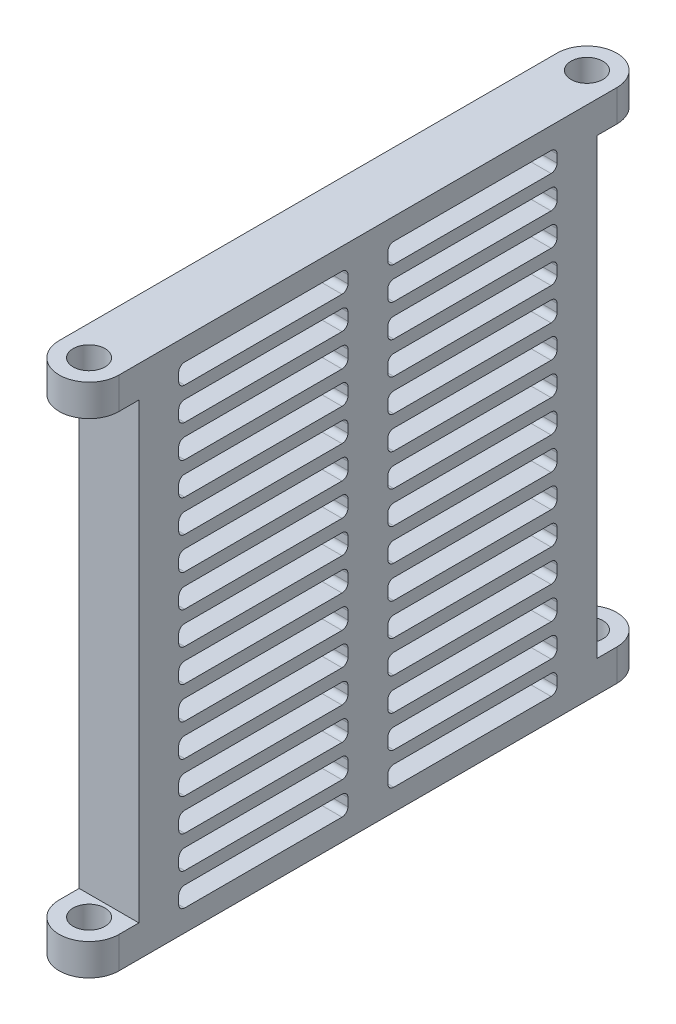
from build123d import *

# Parameters (mm, degrees)
SKETCH2_R           = 1.6
BOSS_EXTRUDE1_DEPTH = 3.175
SKETCH3_W           = 6
SKETCH3_H           = 46
BOSS_EXTRUDE2_DEPTH = 45.48
CUT_EXTRUDE1_DEPTH  = 75.373038798


with BuildPart() as part:
    # Sketch2 → Boss-Extrude1 (new body)
    with BuildSketch(Plane(origin=(0, 0, 0), x_dir=(1, 0, 0), z_dir=(0, 1, 0))):
        with BuildLine():
            Line((-3, 0), (-3, -50))
            ThreePointArc((-3, -50), (0, -53), (3, -50))
            Line((3, -50), (3, 0))
            ThreePointArc((3, 0), (0, 3), (-3, 0))
        make_face()
        Circle(SKETCH2_R, mode=Mode.SUBTRACT)
        with Locations((0, -50)):
            Circle(SKETCH2_R, mode=Mode.SUBTRACT)
    boss_extrude1 = extrude(amount=BOSS_EXTRUDE1_DEPTH)

    # Sketch3 → Boss-Extrude2 (add)
    with BuildSketch(Plane(origin=(0, 3.175, 0), x_dir=(1, 0, 0), z_dir=(0, 1, 0))):
        with Locations((0, -25)):
            Rectangle(SKETCH3_W, SKETCH3_H)
    extrude(amount=BOSS_EXTRUDE2_DEPTH)

    # Mirror2: Boss-Extrude1 across plane
    add(boss_extrude1.mirror(Plane.ZX.offset(25.915)))

    # Sketch4 → Cut-Extrude1 (cut, through all)
    with BuildSketch(Plane(origin=(3, 0, 0), x_dir=(0, 0, -1), z_dir=(1, 0, 0))):
        with BuildLine():
            Line((-6.6, 7.42357141), (-22.4, 7.42357141))
            ThreePointArc((-22.4, 7.42357141), (-22.824264069, 7.247835479), (-23, 6.82357141))
            Line((-23, 6.82357141), (-23, 6.02357141))
            ThreePointArc((-23, 6.02357141), (-22.824264069, 5.599307341), (-22.4, 5.42357141))
            Line((-22.4, 5.42357141), (-6.6, 5.42357141))
            ThreePointArc((-6.6, 5.42357141), (-6.175735931, 5.599307341), (-6, 6.02357141))
            Line((-6, 6.02357141), (-6, 6.82357141))
            ThreePointArc((-6, 6.82357141), (-6.175735931, 7.247835479), (-6.6, 7.42357141))
        make_face()
        with BuildLine():
            Line((-6.6, 49.655), (-22.4, 49.655))
            ThreePointArc((-22.4, 49.655), (-22.824264069, 49.479264069), (-23, 49.055))
            Line((-23, 49.055), (-23, 48.255))
            ThreePointArc((-23, 48.255), (-22.824264069, 47.830735931), (-22.4, 47.655))
            Line((-22.4, 47.655), (-6.6, 47.655))
            ThreePointArc((-6.6, 47.655), (-6.175735931, 47.830735931), (-6, 48.255))
            Line((-6, 48.255), (-6, 49.055))
            ThreePointArc((-6, 49.055), (-6.175735931, 49.479264069), (-6.6, 49.655))
        make_face()
        with BuildLine():
            Line((-6.6, 46.40642857), (-22.4, 46.40642857))
            ThreePointArc((-22.4, 46.40642857), (-22.824264069, 46.230692639), (-23, 45.80642857))
            Line((-23, 45.80642857), (-23, 45.00642857))
            ThreePointArc((-23, 45.00642857), (-22.824264069, 44.582164501), (-22.4, 44.40642857))
            Line((-22.4, 44.40642857), (-6.6, 44.40642857))
            ThreePointArc((-6.6, 44.40642857), (-6.175735931, 44.582164501), (-6, 45.00642857))
            Line((-6, 45.00642857), (-6, 45.80642857))
            ThreePointArc((-6, 45.80642857), (-6.175735931, 46.230692639), (-6.6, 46.40642857))
        make_face()
        with BuildLine():
            Line((-6.6, 43.15785714), (-22.4, 43.15785714))
            ThreePointArc((-22.4, 43.15785714), (-22.824264069, 42.982121209), (-23, 42.55785714))
            Line((-23, 42.55785714), (-23, 41.75785714))
            ThreePointArc((-23, 41.75785714), (-22.824264069, 41.333593071), (-22.4, 41.15785714))
            Line((-22.4, 41.15785714), (-6.6, 41.15785714))
            ThreePointArc((-6.6, 41.15785714), (-6.175735931, 41.333593071), (-6, 41.75785714))
            Line((-6, 41.75785714), (-6, 42.55785714))
            ThreePointArc((-6, 42.55785714), (-6.175735931, 42.982121209), (-6.6, 43.15785714))
        make_face()
        with BuildLine():
            Line((-6.6, 39.90928571), (-22.4, 39.90928571))
            ThreePointArc((-22.4, 39.90928571), (-22.824264069, 39.733549779), (-23, 39.30928571))
            Line((-23, 39.30928571), (-23, 38.50928571))
            ThreePointArc((-23, 38.50928571), (-22.824264069, 38.085021641), (-22.4, 37.90928571))
            Line((-22.4, 37.90928571), (-6.6, 37.90928571))
            ThreePointArc((-6.6, 37.90928571), (-6.175735931, 38.085021641), (-6, 38.50928571))
            Line((-6, 38.50928571), (-6, 39.30928571))
            ThreePointArc((-6, 39.30928571), (-6.175735931, 39.733549779), (-6.6, 39.90928571))
        make_face()
        with BuildLine():
            Line((-6.6, 36.66071428), (-22.4, 36.66071428))
            ThreePointArc((-22.4, 36.66071428), (-22.824264069, 36.484978349), (-23, 36.06071428))
            Line((-23, 36.06071428), (-23, 35.26071428))
            ThreePointArc((-23, 35.26071428), (-22.824264069, 34.836450211), (-22.4, 34.66071428))
            Line((-22.4, 34.66071428), (-6.6, 34.66071428))
            ThreePointArc((-6.6, 34.66071428), (-6.175735931, 34.836450211), (-6, 35.26071428))
            Line((-6, 35.26071428), (-6, 36.06071428))
            ThreePointArc((-6, 36.06071428), (-6.175735931, 36.484978349), (-6.6, 36.66071428))
        make_face()
        with BuildLine():
            Line((-6.6, 33.41214285), (-22.4, 33.41214285))
            ThreePointArc((-22.4, 33.41214285), (-22.824264069, 33.236406919), (-23, 32.81214285))
            Line((-23, 32.81214285), (-23, 32.01214285))
            ThreePointArc((-23, 32.01214285), (-22.824264069, 31.587878781), (-22.4, 31.41214285))
            Line((-22.4, 31.41214285), (-6.6, 31.41214285))
            ThreePointArc((-6.6, 31.41214285), (-6.175735931, 31.587878781), (-6, 32.01214285))
            Line((-6, 32.01214285), (-6, 32.81214285))
            ThreePointArc((-6, 32.81214285), (-6.175735931, 33.236406919), (-6.6, 33.41214285))
        make_face()
        with BuildLine():
            Line((-6.6, 4.17499998), (-22.4, 4.17499998))
            ThreePointArc((-22.4, 4.17499998), (-22.824264069, 3.999264049), (-23, 3.57499998))
            Line((-23, 3.57499998), (-23, 2.77499998))
            ThreePointArc((-23, 2.77499998), (-22.824264069, 2.350735911), (-22.4, 2.17499998))
            Line((-22.4, 2.17499998), (-6.6, 2.17499998))
            ThreePointArc((-6.6, 2.17499998), (-6.175735931, 2.350735911), (-6, 2.77499998))
            Line((-6, 2.77499998), (-6, 3.57499998))
            ThreePointArc((-6, 3.57499998), (-6.175735931, 3.999264049), (-6.6, 4.17499998))
        make_face()
        with BuildLine():
            Line((-6.6, 30.16357142), (-22.4, 30.16357142))
            ThreePointArc((-22.4, 30.16357142), (-22.824264069, 29.987835489), (-23, 29.56357142))
            Line((-23, 29.56357142), (-23, 28.76357142))
            ThreePointArc((-23, 28.76357142), (-22.824264069, 28.339307351), (-22.4, 28.16357142))
            Line((-22.4, 28.16357142), (-6.6, 28.16357142))
            ThreePointArc((-6.6, 28.16357142), (-6.175735931, 28.339307351), (-6, 28.76357142))
            Line((-6, 28.76357142), (-6, 29.56357142))
            ThreePointArc((-6, 29.56357142), (-6.175735931, 29.987835489), (-6.6, 30.16357142))
        make_face()
        with BuildLine():
            Line((-6.6, 26.91499999), (-22.4, 26.91499999))
            ThreePointArc((-22.4, 26.91499999), (-22.824264069, 26.739264059), (-23, 26.31499999))
            Line((-23, 26.31499999), (-23, 25.51499999))
            ThreePointArc((-23, 25.51499999), (-22.824264069, 25.090735921), (-22.4, 24.91499999))
            Line((-22.4, 24.91499999), (-6.6, 24.91499999))
            ThreePointArc((-6.6, 24.91499999), (-6.175735931, 25.090735921), (-6, 25.51499999))
            Line((-6, 25.51499999), (-6, 26.31499999))
            ThreePointArc((-6, 26.31499999), (-6.175735931, 26.739264059), (-6.6, 26.91499999))
        make_face()
        with BuildLine():
            Line((-6.6, 23.66642856), (-22.4, 23.66642856))
            ThreePointArc((-22.4, 23.66642856), (-22.824264069, 23.490692629), (-23, 23.06642856))
            Line((-23, 23.06642856), (-23, 22.26642856))
            ThreePointArc((-23, 22.26642856), (-22.824264069, 21.842164491), (-22.4, 21.66642856))
            Line((-22.4, 21.66642856), (-6.6, 21.66642856))
            ThreePointArc((-6.6, 21.66642856), (-6.175735931, 21.842164491), (-6, 22.26642856))
            Line((-6, 22.26642856), (-6, 23.06642856))
            ThreePointArc((-6, 23.06642856), (-6.175735931, 23.490692629), (-6.6, 23.66642856))
        make_face()
        with BuildLine():
            Line((-6.6, 20.41785713), (-22.4, 20.41785713))
            ThreePointArc((-22.4, 20.41785713), (-22.824264069, 20.242121199), (-23, 19.81785713))
            Line((-23, 19.81785713), (-23, 19.01785713))
            ThreePointArc((-23, 19.01785713), (-22.824264069, 18.593593061), (-22.4, 18.41785713))
            Line((-22.4, 18.41785713), (-6.6, 18.41785713))
            ThreePointArc((-6.6, 18.41785713), (-6.175735931, 18.593593061), (-6, 19.01785713))
            Line((-6, 19.01785713), (-6, 19.81785713))
            ThreePointArc((-6, 19.81785713), (-6.175735931, 20.242121199), (-6.6, 20.41785713))
        make_face()
        with BuildLine():
            Line((-6.6, 17.1692857), (-22.4, 17.1692857))
            ThreePointArc((-22.4, 17.1692857), (-22.824264069, 16.993549769), (-23, 16.5692857))
            Line((-23, 16.5692857), (-23, 15.7692857))
            ThreePointArc((-23, 15.7692857), (-22.824264069, 15.345021631), (-22.4, 15.1692857))
            Line((-22.4, 15.1692857), (-6.6, 15.1692857))
            ThreePointArc((-6.6, 15.1692857), (-6.175735931, 15.345021631), (-6, 15.7692857))
            Line((-6, 15.7692857), (-6, 16.5692857))
            ThreePointArc((-6, 16.5692857), (-6.175735931, 16.993549769), (-6.6, 17.1692857))
        make_face()
        with BuildLine():
            Line((-6.6, 13.92071427), (-22.4, 13.92071427))
            ThreePointArc((-22.4, 13.92071427), (-22.824264069, 13.744978339), (-23, 13.32071427))
            Line((-23, 13.32071427), (-23, 12.52071427))
            ThreePointArc((-23, 12.52071427), (-22.824264069, 12.096450201), (-22.4, 11.92071427))
            Line((-22.4, 11.92071427), (-6.6, 11.92071427))
            ThreePointArc((-6.6, 11.92071427), (-6.175735931, 12.096450201), (-6, 12.52071427))
            Line((-6, 12.52071427), (-6, 13.32071427))
            ThreePointArc((-6, 13.32071427), (-6.175735931, 13.744978339), (-6.6, 13.92071427))
        make_face()
        with BuildLine():
            Line((-6.6, 10.67214284), (-22.4, 10.67214284))
            ThreePointArc((-22.4, 10.67214284), (-22.824264069, 10.496406909), (-23, 10.07214284))
            Line((-23, 10.07214284), (-23, 9.27214284))
            ThreePointArc((-23, 9.27214284), (-22.824264069, 8.847878771), (-22.4, 8.67214284))
            Line((-22.4, 8.67214284), (-6.6, 8.67214284))
            ThreePointArc((-6.6, 8.67214284), (-6.175735931, 8.847878771), (-6, 9.27214284))
            Line((-6, 9.27214284), (-6, 10.07214284))
            ThreePointArc((-6, 10.07214284), (-6.175735931, 10.496406909), (-6.6, 10.67214284))
        make_face()
        with BuildLine():
            Line((-27, 10.07214284), (-27, 9.27214284))
            ThreePointArc((-27, 9.27214284), (-27.175735931, 8.847878771), (-27.6, 8.67214284))
            Line((-27.6, 8.67214284), (-43.4, 8.67214284))
            ThreePointArc((-43.4, 8.67214284), (-43.824264069, 8.847878771), (-44, 9.27214284))
            Line((-44, 9.27214284), (-44, 10.07214284))
            ThreePointArc((-44, 10.07214284), (-43.824264069, 10.496406909), (-43.4, 10.67214284))
            Line((-43.4, 10.67214284), (-27.6, 10.67214284))
            ThreePointArc((-27.6, 10.67214284), (-27.175735931, 10.496406909), (-27, 10.07214284))
        make_face()
        with BuildLine():
            Line((-27, 13.32071427), (-27, 12.52071427))
            ThreePointArc((-27, 12.52071427), (-27.175735931, 12.096450201), (-27.6, 11.92071427))
            Line((-27.6, 11.92071427), (-43.4, 11.92071427))
            ThreePointArc((-43.4, 11.92071427), (-43.824264069, 12.096450201), (-44, 12.52071427))
            Line((-44, 12.52071427), (-44, 13.32071427))
            ThreePointArc((-44, 13.32071427), (-43.824264069, 13.744978339), (-43.4, 13.92071427))
            Line((-43.4, 13.92071427), (-27.6, 13.92071427))
            ThreePointArc((-27.6, 13.92071427), (-27.175735931, 13.744978339), (-27, 13.32071427))
        make_face()
        with BuildLine():
            Line((-27, 16.5692857), (-27, 15.7692857))
            ThreePointArc((-27, 15.7692857), (-27.175735931, 15.345021631), (-27.6, 15.1692857))
            Line((-27.6, 15.1692857), (-43.4, 15.1692857))
            ThreePointArc((-43.4, 15.1692857), (-43.824264069, 15.345021631), (-44, 15.7692857))
            Line((-44, 15.7692857), (-44, 16.5692857))
            ThreePointArc((-44, 16.5692857), (-43.824264069, 16.993549769), (-43.4, 17.1692857))
            Line((-43.4, 17.1692857), (-27.6, 17.1692857))
            ThreePointArc((-27.6, 17.1692857), (-27.175735931, 16.993549769), (-27, 16.5692857))
        make_face()
        with BuildLine():
            Line((-27, 19.81785713), (-27, 19.01785713))
            ThreePointArc((-27, 19.01785713), (-27.175735931, 18.593593061), (-27.6, 18.41785713))
            Line((-27.6, 18.41785713), (-43.4, 18.41785713))
            ThreePointArc((-43.4, 18.41785713), (-43.824264069, 18.593593061), (-44, 19.01785713))
            Line((-44, 19.01785713), (-44, 19.81785713))
            ThreePointArc((-44, 19.81785713), (-43.824264069, 20.242121199), (-43.4, 20.41785713))
            Line((-43.4, 20.41785713), (-27.6, 20.41785713))
            ThreePointArc((-27.6, 20.41785713), (-27.175735931, 20.242121199), (-27, 19.81785713))
        make_face()
        with BuildLine():
            Line((-27, 23.06642856), (-27, 22.26642856))
            ThreePointArc((-27, 22.26642856), (-27.175735931, 21.842164491), (-27.6, 21.66642856))
            Line((-27.6, 21.66642856), (-43.4, 21.66642856))
            ThreePointArc((-43.4, 21.66642856), (-43.824264069, 21.842164491), (-44, 22.26642856))
            Line((-44, 22.26642856), (-44, 23.06642856))
            ThreePointArc((-44, 23.06642856), (-43.824264069, 23.490692629), (-43.4, 23.66642856))
            Line((-43.4, 23.66642856), (-27.6, 23.66642856))
            ThreePointArc((-27.6, 23.66642856), (-27.175735931, 23.490692629), (-27, 23.06642856))
        make_face()
        with BuildLine():
            Line((-27, 26.31499999), (-27, 25.51499999))
            ThreePointArc((-27, 25.51499999), (-27.175735931, 25.090735921), (-27.6, 24.91499999))
            Line((-27.6, 24.91499999), (-43.4, 24.91499999))
            ThreePointArc((-43.4, 24.91499999), (-43.824264069, 25.090735921), (-44, 25.51499999))
            Line((-44, 25.51499999), (-44, 26.31499999))
            ThreePointArc((-44, 26.31499999), (-43.824264069, 26.739264059), (-43.4, 26.91499999))
            Line((-43.4, 26.91499999), (-27.6, 26.91499999))
            ThreePointArc((-27.6, 26.91499999), (-27.175735931, 26.739264059), (-27, 26.31499999))
        make_face()
        with BuildLine():
            Line((-27, 29.56357142), (-27, 28.76357142))
            ThreePointArc((-27, 28.76357142), (-27.175735931, 28.339307351), (-27.6, 28.16357142))
            Line((-27.6, 28.16357142), (-43.4, 28.16357142))
            ThreePointArc((-43.4, 28.16357142), (-43.824264069, 28.339307351), (-44, 28.76357142))
            Line((-44, 28.76357142), (-44, 29.56357142))
            ThreePointArc((-44, 29.56357142), (-43.824264069, 29.987835489), (-43.4, 30.16357142))
            Line((-43.4, 30.16357142), (-27.6, 30.16357142))
            ThreePointArc((-27.6, 30.16357142), (-27.175735931, 29.987835489), (-27, 29.56357142))
        make_face()
        with BuildLine():
            Line((-27, 32.81214285), (-27, 32.01214285))
            ThreePointArc((-27, 32.01214285), (-27.175735931, 31.587878781), (-27.6, 31.41214285))
            Line((-27.6, 31.41214285), (-43.4, 31.41214285))
            ThreePointArc((-43.4, 31.41214285), (-43.824264069, 31.587878781), (-44, 32.01214285))
            Line((-44, 32.01214285), (-44, 32.81214285))
            ThreePointArc((-44, 32.81214285), (-43.824264069, 33.236406919), (-43.4, 33.41214285))
            Line((-43.4, 33.41214285), (-27.6, 33.41214285))
            ThreePointArc((-27.6, 33.41214285), (-27.175735931, 33.236406919), (-27, 32.81214285))
        make_face()
        with BuildLine():
            Line((-27, 3.57499998), (-27, 2.77499998))
            ThreePointArc((-27, 2.77499998), (-27.175735931, 2.350735911), (-27.6, 2.17499998))
            Line((-27.6, 2.17499998), (-43.4, 2.17499998))
            ThreePointArc((-43.4, 2.17499998), (-43.824264069, 2.350735911), (-44, 2.77499998))
            Line((-44, 2.77499998), (-44, 3.57499998))
            ThreePointArc((-44, 3.57499998), (-43.824264069, 3.999264049), (-43.4, 4.17499998))
            Line((-43.4, 4.17499998), (-27.6, 4.17499998))
            ThreePointArc((-27.6, 4.17499998), (-27.175735931, 3.999264049), (-27, 3.57499998))
        make_face()
        with BuildLine():
            Line((-27, 36.06071428), (-27, 35.26071428))
            ThreePointArc((-27, 35.26071428), (-27.175735931, 34.836450211), (-27.6, 34.66071428))
            Line((-27.6, 34.66071428), (-43.4, 34.66071428))
            ThreePointArc((-43.4, 34.66071428), (-43.824264069, 34.836450211), (-44, 35.26071428))
            Line((-44, 35.26071428), (-44, 36.06071428))
            ThreePointArc((-44, 36.06071428), (-43.824264069, 36.484978349), (-43.4, 36.66071428))
            Line((-43.4, 36.66071428), (-27.6, 36.66071428))
            ThreePointArc((-27.6, 36.66071428), (-27.175735931, 36.484978349), (-27, 36.06071428))
        make_face()
        with BuildLine():
            Line((-27, 39.30928571), (-27, 38.50928571))
            ThreePointArc((-27, 38.50928571), (-27.175735931, 38.085021641), (-27.6, 37.90928571))
            Line((-27.6, 37.90928571), (-43.4, 37.90928571))
            ThreePointArc((-43.4, 37.90928571), (-43.824264069, 38.085021641), (-44, 38.50928571))
            Line((-44, 38.50928571), (-44, 39.30928571))
            ThreePointArc((-44, 39.30928571), (-43.824264069, 39.733549779), (-43.4, 39.90928571))
            Line((-43.4, 39.90928571), (-27.6, 39.90928571))
            ThreePointArc((-27.6, 39.90928571), (-27.175735931, 39.733549779), (-27, 39.30928571))
        make_face()
        with BuildLine():
            Line((-27, 42.55785714), (-27, 41.75785714))
            ThreePointArc((-27, 41.75785714), (-27.175735931, 41.333593071), (-27.6, 41.15785714))
            Line((-27.6, 41.15785714), (-43.4, 41.15785714))
            ThreePointArc((-43.4, 41.15785714), (-43.824264069, 41.333593071), (-44, 41.75785714))
            Line((-44, 41.75785714), (-44, 42.55785714))
            ThreePointArc((-44, 42.55785714), (-43.824264069, 42.982121209), (-43.4, 43.15785714))
            Line((-43.4, 43.15785714), (-27.6, 43.15785714))
            ThreePointArc((-27.6, 43.15785714), (-27.175735931, 42.982121209), (-27, 42.55785714))
        make_face()
        with BuildLine():
            Line((-27, 45.80642857), (-27, 45.00642857))
            ThreePointArc((-27, 45.00642857), (-27.175735931, 44.582164501), (-27.6, 44.40642857))
            Line((-27.6, 44.40642857), (-43.4, 44.40642857))
            ThreePointArc((-43.4, 44.40642857), (-43.824264069, 44.582164501), (-44, 45.00642857))
            Line((-44, 45.00642857), (-44, 45.80642857))
            ThreePointArc((-44, 45.80642857), (-43.824264069, 46.230692639), (-43.4, 46.40642857))
            Line((-43.4, 46.40642857), (-27.6, 46.40642857))
            ThreePointArc((-27.6, 46.40642857), (-27.175735931, 46.230692639), (-27, 45.80642857))
        make_face()
        with BuildLine():
            Line((-27, 49.055), (-27, 48.255))
            ThreePointArc((-27, 48.255), (-27.175735931, 47.830735931), (-27.6, 47.655))
            Line((-27.6, 47.655), (-43.4, 47.655))
            ThreePointArc((-43.4, 47.655), (-43.824264069, 47.830735931), (-44, 48.255))
            Line((-44, 48.255), (-44, 49.055))
            ThreePointArc((-44, 49.055), (-43.824264069, 49.479264069), (-43.4, 49.655))
            Line((-43.4, 49.655), (-27.6, 49.655))
            ThreePointArc((-27.6, 49.655), (-27.175735931, 49.479264069), (-27, 49.055))
        make_face()
        with BuildLine():
            Line((-27, 6.82357141), (-27, 6.02357141))
            ThreePointArc((-27, 6.02357141), (-27.175735931, 5.599307341), (-27.6, 5.42357141))
            Line((-27.6, 5.42357141), (-43.4, 5.42357141))
            ThreePointArc((-43.4, 5.42357141), (-43.824264069, 5.599307341), (-44, 6.02357141))
            Line((-44, 6.02357141), (-44, 6.82357141))
            ThreePointArc((-44, 6.82357141), (-43.824264069, 7.247835479), (-43.4, 7.42357141))
            Line((-43.4, 7.42357141), (-27.6, 7.42357141))
            ThreePointArc((-27.6, 7.42357141), (-27.175735931, 7.247835479), (-27, 6.82357141))
        make_face()
    extrude(amount=-CUT_EXTRUDE1_DEPTH, mode=Mode.SUBTRACT)


solid = part.part
